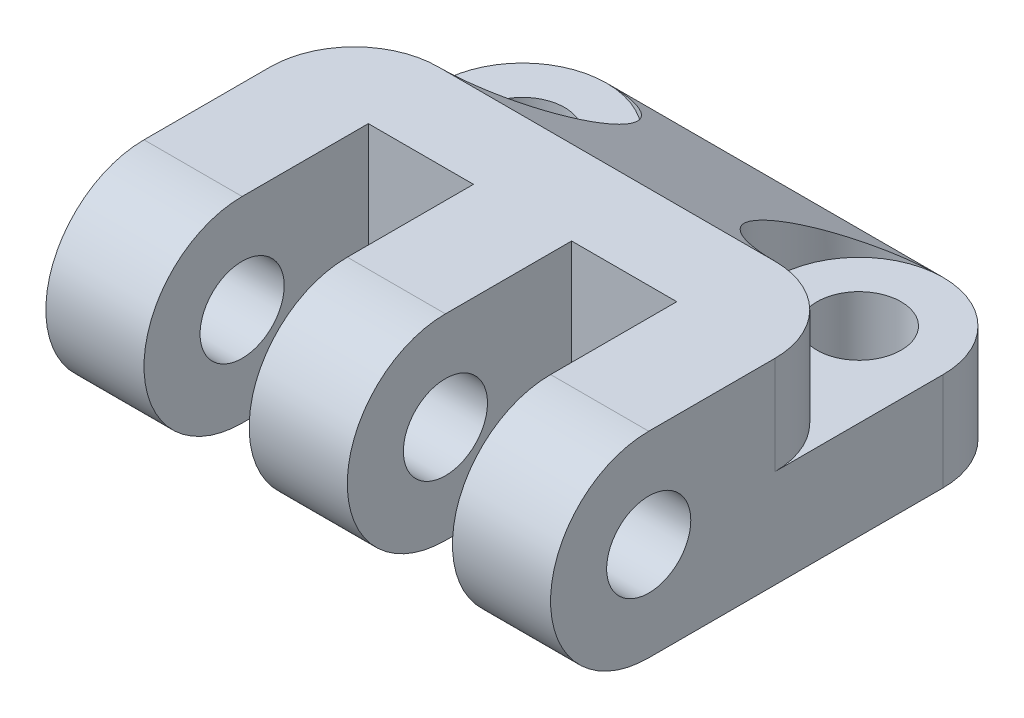
from build123d import *

# Parameters (mm, degrees)
SKETCH1_W           = 18
SKETCH1_H           = 9
BOSS_EXTRUDE1_DEPTH = 3.5
SKETCH2_R           = 1.5
CUT_EXTRUDE1_DEPTH  = 11.653637876
BOSS_EXTRUDE3_DEPTH = 7
CUT_EXTRUDE3_DEPTH  = 24.005434141
SKETCH8_R           = 1.5
CUT_EXTRUDE4_DEPTH  = 24.005434141
FILLET1_R           = 3
CUT_EXTRUDE5_DEPTH  = 24.005434141


with BuildPart() as part:
    # Sketch1 → Boss-Extrude1 (new body)
    with BuildSketch(Plane(origin=(0, 0, 0), x_dir=(1, 0, 0), z_dir=(0, 1, 0))):
        Rectangle(SKETCH1_W, SKETCH1_H)
    extrude(amount=BOSS_EXTRUDE1_DEPTH)

    # Sketch2 → Cut-Extrude1 (cut, through all)
    with BuildSketch(Plane(origin=(0, 3.5, 0), x_dir=(1, 0, 0), z_dir=(0, 1, 0))):
        with Locations((-6, 1.5)):
            Circle(SKETCH2_R)
        with Locations((6, 1.5)):
            Circle(SKETCH2_R)
    extrude(amount=-CUT_EXTRUDE1_DEPTH, mode=Mode.SUBTRACT)

    # Sketch4 → Boss-Extrude3 (add)
    with BuildSketch(Plane.XZ):
        with BuildLine():
            Line((-1.75, 12.5), (1.75, 12.5))
            Line((1.75, 12.5), (1.75, 4.5))
            Line((1.75, 4.5), (5.5, 4.5))
            Line((5.5, 4.5), (5.5, 12.5))
            Line((5.5, 12.5), (9, 12.5))
            Line((9, 12.5), (9, 4.5))
            ThreePointArc((9, 4.5), (8.121320344, 2.378679656), (6, 1.5))
            ThreePointArc((6, 1.5), (3.878679656, 0.621320344), (3, -1.5))
            ThreePointArc((3, -1.5), (3.878679656, -3.621320344), (6, -4.5))
            Line((6, -4.5), (-6, -4.5))
            ThreePointArc((-6, -4.5), (-3.878679656, -3.621320344), (-3, -1.5))
            ThreePointArc((-3, -1.5), (-3.878679656, 0.621320344), (-6, 1.5))
            ThreePointArc((-6, 1.5), (-8.121320344, 2.378679656), (-9, 4.5))
            Line((-9, 4.5), (-9, 12.5))
            Line((-9, 12.5), (-5.5, 12.5))
            Line((-5.5, 12.5), (-5.5, 4.5))
            Line((-5.5, 4.5), (-1.75, 4.5))
            Line((-1.75, 4.5), (-1.75, 12.5))
        make_face()
    extrude(amount=-BOSS_EXTRUDE3_DEPTH)

    # Sketch7 → Cut-Extrude3 (cut, through all)
    with BuildSketch(Plane(origin=(9, 0, 0), x_dir=(0, 0, -1), z_dir=(1, 0, 0))):
        with BuildLine():
            ThreePointArc((-12.5, 3.5), (-11.474873734, 5.974873734), (-9, 7))
            Line((-9, 7), (-12.5, 7))
            Line((-12.5, 7), (-12.5, 3.5))
        make_face()
        with BuildLine():
            ThreePointArc((-9, 0), (-11.474873734, 1.025126266), (-12.5, 3.5))
            Line((-12.5, 3.5), (-12.5, 0))
            Line((-12.5, 0), (-9, 0))
        make_face()
    extrude(amount=-CUT_EXTRUDE3_DEPTH, mode=Mode.SUBTRACT)

    # Sketch8 → Cut-Extrude4 (cut, through all)
    with BuildSketch(Plane(origin=(9, 0, 0), x_dir=(0, 0, -1), z_dir=(1, 0, 0))):
        with Locations((-9, 3.5)):
            Circle(SKETCH8_R)
    extrude(amount=-CUT_EXTRUDE4_DEPTH, mode=Mode.SUBTRACT)

    # Fillet1
    fillet1_edges = [part.edges().sort_by_distance(p)[0] for p in [
        (-9, 1.75, -4.5),
        (9, 1.75, -4.5),
    ]]
    fillet(fillet1_edges, radius=FILLET1_R)

    # Sketch6 → Cut-Extrude5 (cut, through all)
    with BuildSketch(Plane(origin=(9, 0, 0), x_dir=(0, 0, -1), z_dir=(1, 0, 0))):
        Polygon((-1.5, 7), (4.5, 3.5), (4.5, 7), align=None)
    extrude(amount=-CUT_EXTRUDE5_DEPTH, mode=Mode.SUBTRACT)


solid = part.part
